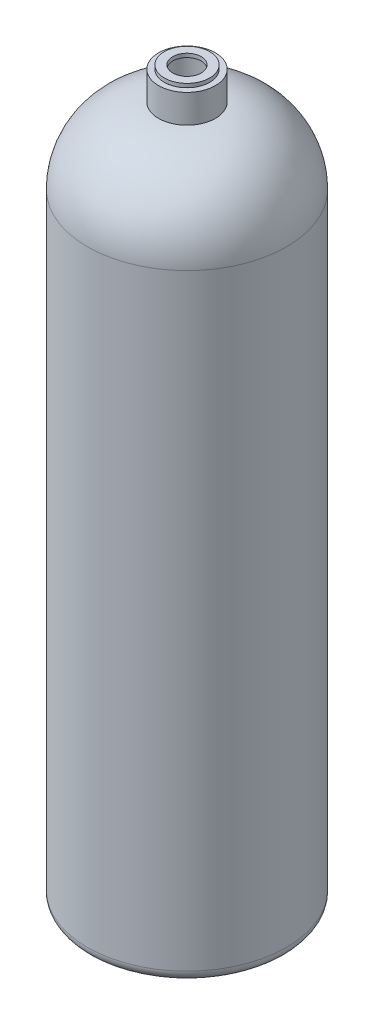
from build123d import *

# Parameters (mm, degrees)
SKETCH1_R           = 66.675
BOSS_EXTRUDE1_DEPTH = 414.02
SKETCH2_R           = 66.675
BOSS_EXTRUDE2_DEPTH = 50.8
SKETCH3_R           = 19.05
BOSS_EXTRUDE3_DEPTH = 19.05
FILLET1_R           = 50.8
FILLET2_R           = 7.62
SKETCH4_R           = 15.24
SKETCH4_R_2         = 9.525
BOSS_EXTRUDE4_DEPTH = 2.54


# Read off the part's stored shape, not the designer's step: Shell2
with BuildPart() as part:
    # Sketch1 → Boss-Extrude1 (new body)
    with BuildSketch(Plane(origin=(0, 0, 0), x_dir=(1, 0, 0), z_dir=(0, 1, 0))):
        with Locations(Location((0, 0, 0), (0, 0, 270))):
            Circle(SKETCH1_R)
    extrude(amount=BOSS_EXTRUDE1_DEPTH)

    # Sketch2 → Boss-Extrude2 (add)
    with BuildSketch(Plane(origin=(0, 414.02, 0), x_dir=(1, 0, 0), z_dir=(0, 1, 0))):
        with Locations(Location((0, 0, 0), (0, 0, 270))):
            Circle(SKETCH2_R)
    extrude(amount=BOSS_EXTRUDE2_DEPTH)

    # Sketch3 → Boss-Extrude3 (add)
    with BuildSketch(Plane(origin=(0, 464.82, 0), x_dir=(1, 0, 0), z_dir=(0, 1, 0))):
        with Locations(Location((0, 0, 0), (0, 0, 90))):
            Circle(SKETCH3_R)
    extrude(amount=BOSS_EXTRUDE3_DEPTH)

    # Fillet1
    # the kernel refuses this fillet: 50.8 mm, written as the material it takes off along each edge
    with BuildSketch(Plane(origin=(0, 464.82, 0), x_dir=(0, 0, 1), z_dir=(-1, 0, 0))) as fillet1_piece_1:
        with BuildLine():
            CenterArc((15.875, -50.700684167), FILLET1_R, 0, 86.416678302)
            Line((19.05, 0), (19.1135, 1.014013683))
            ThreePointArc((19.1135, 1.014013683), (42.8625, 1.016), (66.675, 1.016))
            Line((66.675, 1.016), (67.691, 0))
            Line((67.691, 0), (67.691, -50.700684167))
            Line((67.691, -50.700684167), (66.675, -50.700684167))
        make_face()
    revolve(axis=Axis((0, 464.82, 0), (0, 1, 0)), mode=Mode.SUBTRACT)

    # Fillet2
    fillet2_edges = [part.edges().sort_by_distance(p)[0] for p in [
        (0, 0, -66.675),
    ]]
    fillet(fillet2_edges, radius=FILLET2_R)

    # Shell2 outline → Shell2 (revolve, cut)
    with BuildSketch(Plane.XY):
        with BuildLine():
            Line((62.865, 7.62), (62.865, 414.119315833))
            ThreePointArc((62.865, 414.119315833), (48.876677609, 447.570016498), (15.24, 461.105025097))
            Line((15.24, 461.105025097), (15.24, 483.87))
            Line((15.24, 483.87), (0, 483.87))
            Line((0, 483.87), (0, 3.81))
            Line((0, 3.81), (59.055, 3.81))
            ThreePointArc((59.055, 3.81), (61.749076836, 4.925923164), (62.865, 7.62))
        make_face()
    revolve(axis=Axis((0, 0, 0), (0, 1, 0)), mode=Mode.SUBTRACT)


with BuildPart() as body_2:
    # Sketch4 → Boss-Extrude4 (new body)
    with BuildSketch(Plane(origin=(0, 483.87, 0), x_dir=(1, 0, 0), z_dir=(0, 1, 0))):
        with Locations(Location((0, 0, 0), (0, 0, 270))):
            Circle(SKETCH4_R)
        with Locations(Location((0, 0, 0), (0, 0, 270))):
            Circle(SKETCH4_R_2, mode=Mode.SUBTRACT)
    extrude(amount=BOSS_EXTRUDE4_DEPTH)


solid = Compound([part.part, body_2.part])
